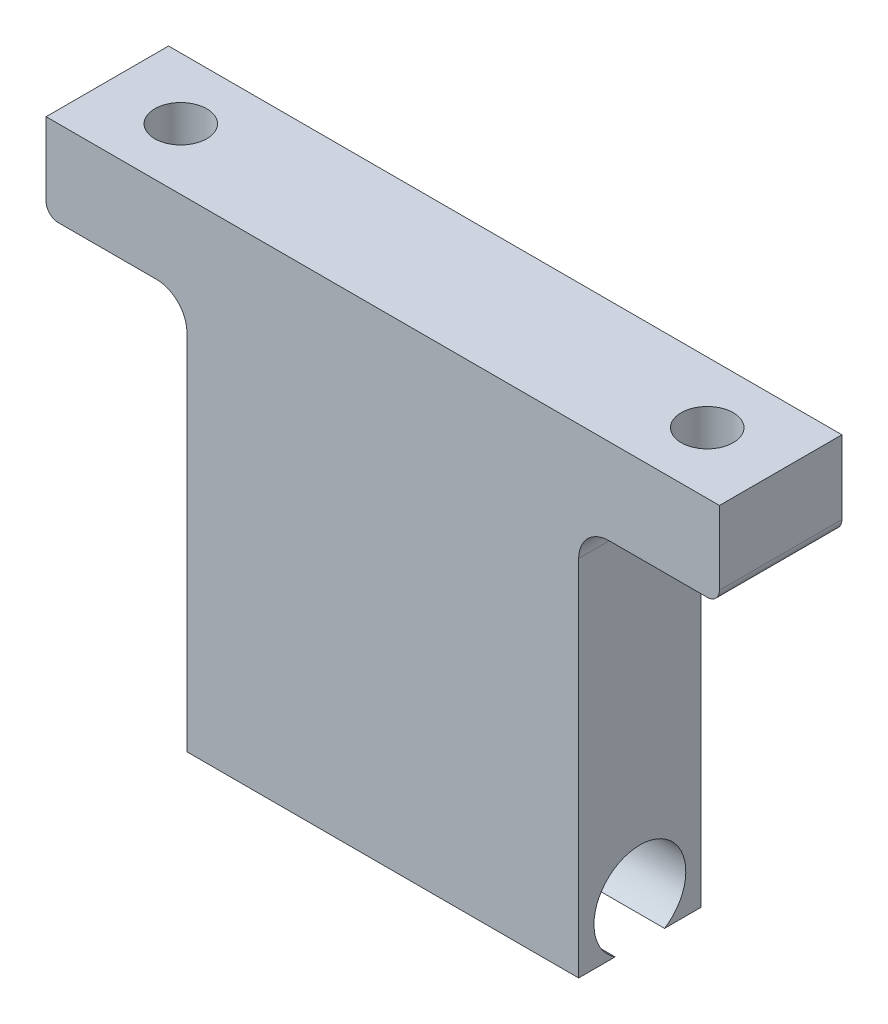
from build123d import *

# Parameters (mm, degrees)
RESSALTO_EXTRUS_O1_DEPTH = 20
ESBO_O4_R                = 7.5
CORTE_EXTRUS_O2_DEPTH    = 205.123197336
ESBO_O5_R                = 4.25
CORTE_EXTRUS_O3_DEPTH    = 287.643795227


with BuildPart() as part:
    # Esboço2 → Ressalto-extrusão1 (new body)
    with BuildSketch(Plane.XY):
        with BuildLine():
            Line((-252, 105.212171492), (-188, 105.212171492))
            Line((-188, 105.212171492), (-188, 164.568188123))
            ThreePointArc((-188, 164.568188123), (-186.535533906, 168.103722028), (-183, 169.568188123))
            Line((-183, 169.568188123), (-167, 169.568188123))
            ThreePointArc((-167, 169.568188123), (-165.585786438, 170.15397456), (-165, 171.568188123))
            Line((-165, 171.568188123), (-165, 183.568188123))
            Line((-165, 183.568188123), (-275, 183.568188123))
            Line((-275, 183.568188123), (-275, 171.568188123))
            ThreePointArc((-275, 171.568188123), (-274.414213562, 170.15397456), (-273, 169.568188123))
            Line((-273, 169.568188123), (-257, 169.568188123))
            ThreePointArc((-257, 169.568188123), (-253.464466094, 168.103722028), (-252, 164.568188123))
            Line((-252, 164.568188123), (-252, 105.212171492))
        make_face()
    extrude(amount=RESSALTO_EXTRUS_O1_DEPTH)

    # Esboço4 → Corte-extrusão2 (cut, through all)
    with BuildSketch(Plane(origin=(-188, 0, 0), x_dir=(0, 0, -1), z_dir=(1, 0, 0))):
        with Locations((-10, 111.538229326)):
            Circle(ESBO_O4_R)
    extrude(amount=-CORTE_EXTRUS_O2_DEPTH, mode=Mode.SUBTRACT)

    # Esboço5 → Corte-extrusão3 (cut, through all)
    with BuildSketch(Plane(origin=(0, 183.568188123, 0), x_dir=(1, 0, 0), z_dir=(0, 1, 0))):
        with Locations((-263, -10)):
            Circle(ESBO_O5_R)
        with Locations((-177, -10)):
            Circle(ESBO_O5_R)
    extrude(amount=-CORTE_EXTRUS_O3_DEPTH, mode=Mode.SUBTRACT)


solid = part.part
